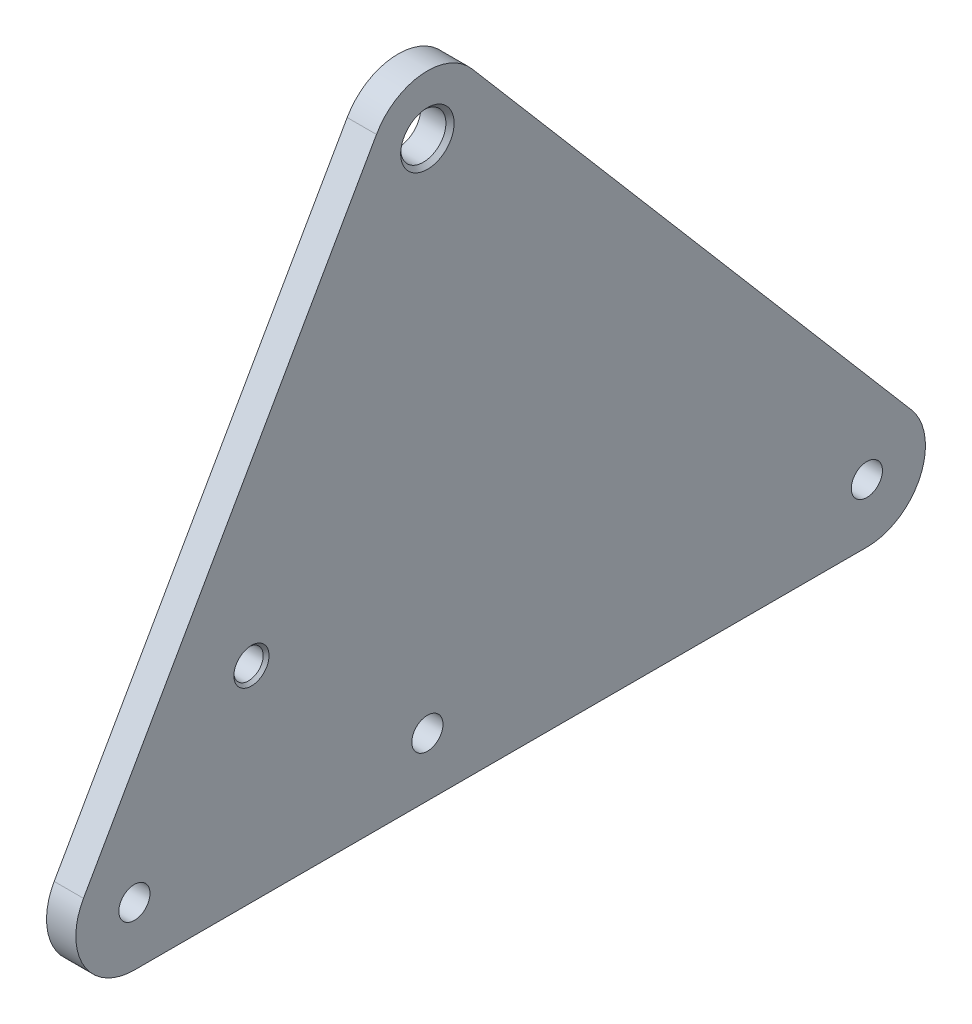
from build123d import *

# Parameters (mm, degrees)
BOSS_EXTRUDE1_DEPTH                  = 6.35
CUT_EXTRUDE1_REACH                   = 166.779
SKETCH2_R                            = 3.3782
F_3_8_CLEARANCE_HOLE1_D              = 9.8044
F_3_8_CLEARANCE_HOLE1_CSINK_D        = 11.58748
F_3_8_CLEARANCE_HOLE1_CSINK_ANGLE    = 90
F_1_4_0_2500_DOWEL_HOLE1_D           = 6.35
F_1_4_0_2500_DOWEL_HOLE1_CSINK_D     = 7.62
F_1_4_0_2500_DOWEL_HOLE1_CSINK_ANGLE = 90


with BuildPart() as part:
    # Sketch1 → Boss-Extrude1 (new body)
    with BuildSketch(Plane(origin=(0, 0, 0), x_dir=(0, 0, -1), z_dir=(1, 0, 0))):
        with BuildLine():
            Line((-74.539032088, -105.353687095), (-11.039032088, 6.279312905))
            ThreePointArc((-11.039032088, 6.279312905), (-1.199563995, 12.643221355), (9.661154553, 8.243305933))
            Line((9.661154553, 8.243305933), (104.911154553, -103.389694067))
            ThreePointArc((104.911154553, -103.389694067), (106.782128714, -116.95277512), (95.25, -124.333))
            Line((95.25, -124.333), (-63.5, -124.333))
            ThreePointArc((-63.5, -124.333), (-74.478098057, -118.018245731), (-74.539032088, -105.353687095))
        make_face()
    extrude(amount=BOSS_EXTRUDE1_DEPTH)

    # Sketch2 → Cut-Extrude1 (cut, up to next)
    with BuildSketch(Plane(origin=(6.35, 0, 0), x_dir=(0, 0, -1), z_dir=(1, 0, 0)), mode=Mode.PRIVATE) as cut_extrude1_sk1:
        with Locations((-63.5, -111.633)):
            Circle(SKETCH2_R)
    cut_extrude1_tool1 = extrude(cut_extrude1_sk1.sketch, amount=-CUT_EXTRUDE1_REACH, mode=Mode.PRIVATE) & part.part
    # Sketch2 → Cut-Extrude1 (cut, up to next)
    with BuildSketch(Plane(origin=(6.35, 0, 0), x_dir=(0, 0, -1), z_dir=(1, 0, 0)), mode=Mode.PRIVATE) as cut_extrude1_sk2:
        with Locations((0, -111.633)):
            Circle(SKETCH2_R)
    cut_extrude1_tool2 = extrude(cut_extrude1_sk2.sketch, amount=-CUT_EXTRUDE1_REACH, mode=Mode.PRIVATE) & part.part
    # Sketch2 → Cut-Extrude1 (cut, up to next)
    with BuildSketch(Plane(origin=(6.35, 0, 0), x_dir=(0, 0, -1), z_dir=(1, 0, 0)), mode=Mode.PRIVATE) as cut_extrude1_sk3:
        with Locations((95.25, -111.633)):
            Circle(SKETCH2_R)
    cut_extrude1_tool3 = extrude(cut_extrude1_sk3.sketch, amount=-CUT_EXTRUDE1_REACH, mode=Mode.PRIVATE) & part.part
    add(cut_extrude1_tool1.solids().sort_by_distance((6.35, -111.633, 63.5))[0], mode=Mode.SUBTRACT)
    add(cut_extrude1_tool2.solids().sort_by_distance((6.35, -111.633, 0))[0], mode=Mode.SUBTRACT)
    add(cut_extrude1_tool3.solids().sort_by_distance((6.35, -111.633, -95.25))[0], mode=Mode.SUBTRACT)

    # 3/8 Clearance Hole1 (through all)
    with Locations(Plane(origin=(6.35, 0, 0), x_dir=(0, 0, -1), z_dir=(1, 0, 0))):
        with Locations((0, 0)):
            CounterSinkHole(F_3_8_CLEARANCE_HOLE1_D / 2, F_3_8_CLEARANCE_HOLE1_CSINK_D / 2, counter_sink_angle=F_3_8_CLEARANCE_HOLE1_CSINK_ANGLE)

    # 1/4 (0.2500) Dowel Hole1 (through all)
    with Locations(Plane(origin=(6.35, 0, 0), x_dir=(0, 0, -1), z_dir=(1, 0, 0))):
        with Locations((-38.134262993, -79.883)):
            CounterSinkHole(F_1_4_0_2500_DOWEL_HOLE1_D / 2, F_1_4_0_2500_DOWEL_HOLE1_CSINK_D / 2, counter_sink_angle=F_1_4_0_2500_DOWEL_HOLE1_CSINK_ANGLE)


solid = part.part
